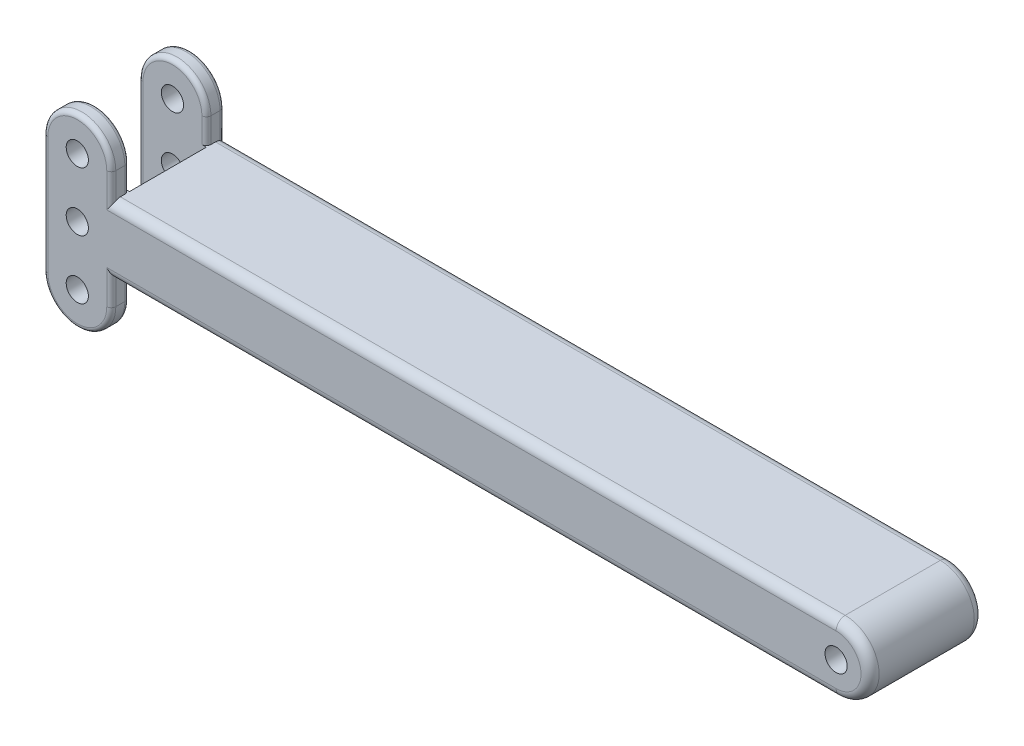
from build123d import *

# Parameters (mm, degrees)
SKETCH1_R           = 3.1115
BOSS_EXTRUDE1_DEPTH = 31.75
SKETCH2_W           = 21.59
SKETCH2_H           = 52.07
CUT_EXTRUDE1_DEPTH  = 19.05
FILLET1_R           = 2.54
FILLET2_R           = 1.27


with BuildPart() as part:
    # Sketch1 → Boss-Extrude1 (new body)
    with BuildSketch(Plane.XY):
        with BuildLine():
            Line((-9.525, 33.02), (-9.525, 0))
            ThreePointArc((-9.525, 0), (0, -9.525), (9.525, 0))
            Line((9.525, 0), (9.525, 6.985))
            Line((9.525, 6.985), (212.725, 6.985))
            ThreePointArc((212.725, 6.985), (222.25, 16.51), (212.725, 26.035))
            Line((212.725, 26.035), (9.525, 26.035))
            Line((9.525, 26.035), (9.525, 33.02))
            ThreePointArc((9.525, 33.02), (0, 42.545), (-9.525, 33.02))
        make_face()
        Circle(SKETCH1_R, mode=Mode.SUBTRACT)
        with Locations((0, 16.51)):
            Circle(SKETCH1_R, mode=Mode.SUBTRACT)
        with Locations((0, 33.02)):
            Circle(SKETCH1_R, mode=Mode.SUBTRACT)
        with Locations((212.725, 16.51)):
            Circle(SKETCH1_R, mode=Mode.SUBTRACT)
    extrude(amount=BOSS_EXTRUDE1_DEPTH)

    # Sketch2 → Cut-Extrude1 (cut)
    with BuildSketch(Plane.ZY.offset(9.525)):
        with Locations((15.875, 16.51)):
            Rectangle(SKETCH2_W, SKETCH2_H)
    extrude(amount=-CUT_EXTRUDE1_DEPTH, mode=Mode.SUBTRACT)

    # Fillet1
    fillet1_edges = [part.edges().sort_by_distance(p)[0] for p in [
        (111.125, 26.035, 0),
        (222.25, 16.51, 0),
        (111.125, 26.035, 31.75),
        (222.25, 16.51, 31.75),
        (111.125, 6.985, 0),
        (111.125, 6.985, 31.75),
    ]]
    fillet(fillet1_edges, radius=FILLET1_R)

    # Fillet2
    fillet2_edges = [part.edges().sort_by_distance(p)[0] for p in [
        (9.525, 3.4925, 26.67),
        (9.525, 29.5275, 26.67),
        (0, 42.545, 26.67),
        (-9.525, 16.51, 26.67),
        (9.525, 28.2575, 0),
        (0, 42.545, 0),
        (-9.525, 16.51, 0),
        (9.525, 4.7625, 0),
        (9.525, 3.4925, 5.08),
        (9.525, 29.5275, 5.08),
        (0, 42.545, 5.08),
        (-9.525, 16.51, 5.08),
        (9.525, 28.2575, 31.75),
        (0, 42.545, 31.75),
        (-9.525, 16.51, 31.75),
        (9.525, 4.7625, 31.75),
        (0, -9.525, 26.67),
        (0, -9.525, 0),
        (0, -9.525, 5.08),
        (0, -9.525, 31.75),
    ]]
    fillet(fillet2_edges, radius=FILLET2_R)


solid = part.part
